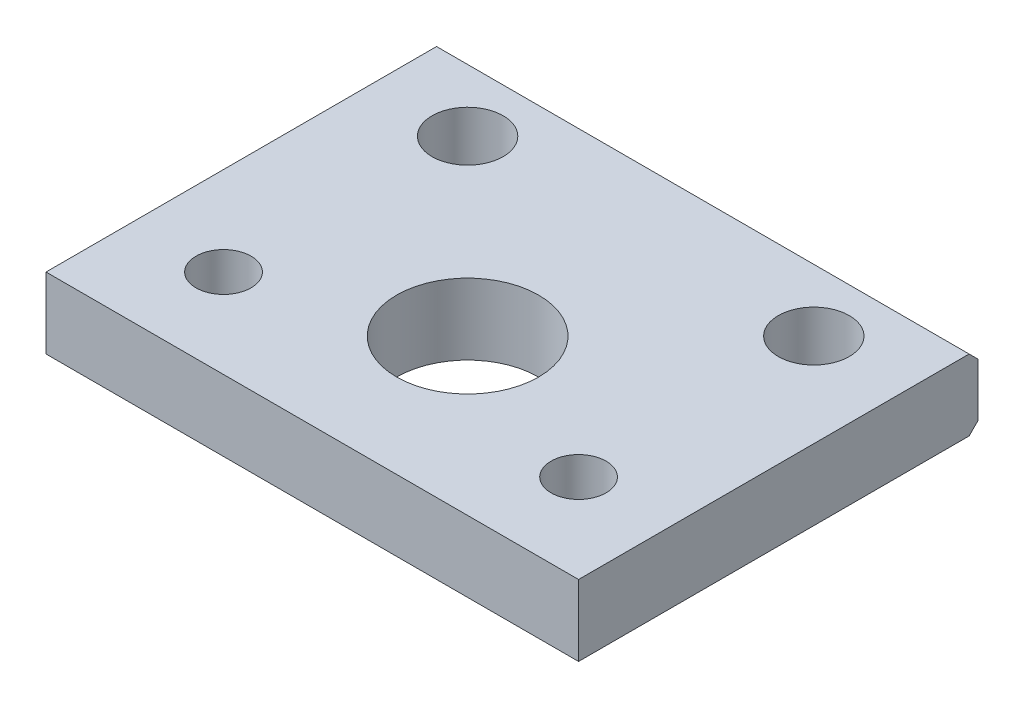
from build123d import *

# Parameters (mm, degrees)
SKETCH_1_W                = 60
SKETCH_1_H                = 45
SKETCH_1_R                = 2.5
SKETCH_1_R_2              = 8
EXTRUDE_1_DEPTH           = 8
CHAMFER_1_SIZE            = 1
SKETCH_2_R                = 4
CUT_EXTRUDE_1_DEPTH       = 6
HOLE_WIZARD_2_D           = 6.2
HOLE_WIZARD_2_CSINK_D     = 13.2
HOLE_WIZARD_2_CSINK_ANGLE = 90


with BuildPart() as part:
    # 草图1 → 凸台-拉伸1 (new body)
    with BuildSketch(Plane(origin=(0, 0, 0), x_dir=(1, 0, 0), z_dir=(0, 1, 0))):
        Rectangle(SKETCH_1_W, SKETCH_1_H)
        with Locations((-20, -12.5)):
            Circle(SKETCH_1_R, mode=Mode.SUBTRACT)
        with Locations((20, -12.5)):
            Circle(SKETCH_1_R, mode=Mode.SUBTRACT)
        with Locations((0, -5)):
            Circle(SKETCH_1_R_2, mode=Mode.SUBTRACT)
    extrude(amount=EXTRUDE_1_DEPTH)

    # 倒角1
    chamfer_1_edges = [part.edges().sort_by_distance(p)[0] for p in [
        (0, 8, -22.5),
        (0, 0, -22.5),
    ]]
    chamfer(chamfer_1_edges, length=CHAMFER_1_SIZE)

    # 草图2 → 切除-拉伸1 (cut)
    with BuildSketch(Plane(origin=(0, 8, 0), x_dir=(1, 0, 0), z_dir=(0, 1, 0))):
        with Locations((-19.5, 14.5)):
            Circle(SKETCH_2_R)
        with Locations((19.5, 14.5)):
            Circle(SKETCH_2_R)
    extrude(amount=-CUT_EXTRUDE_1_DEPTH, mode=Mode.SUBTRACT)

    # Hole Wizard 2 (through all)
    with Locations(Plane(origin=(20, 0, 12.5), x_dir=(0, 0, -1), z_dir=(0, -1, 0))):
        with Locations((0, 0), (0, -40)):
            CounterSinkHole(HOLE_WIZARD_2_D / 2, HOLE_WIZARD_2_CSINK_D / 2, counter_sink_angle=HOLE_WIZARD_2_CSINK_ANGLE)


solid = part.part
